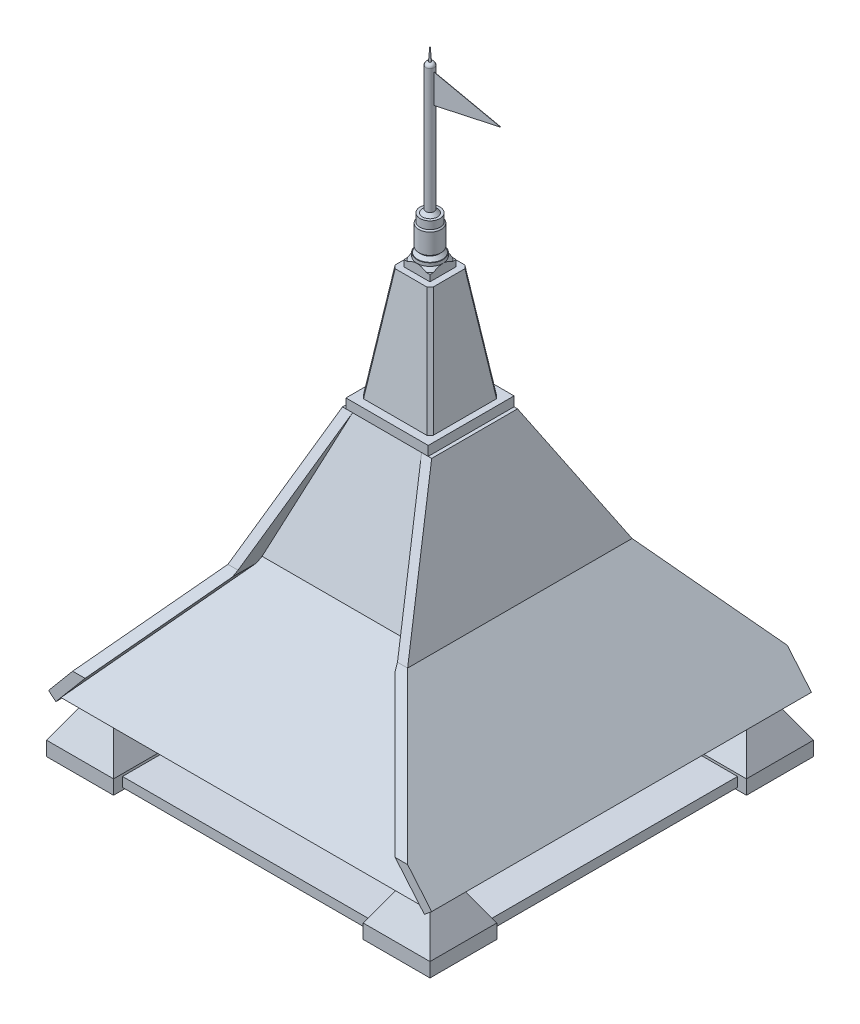
from build123d import *
from OCP.BRepFilletAPI import BRepFilletAPI_MakeChamfer

# Parameters (mm, degrees)
SKETCH2_W                       = 211.424938922
SKETCH2_H                       = 211.424938922
BOSS_EXTRUDE1_DEPTH             = 60
CHAMFER1_SIZE                   = 15
CHAMFER2_SIZE                   = 15
CHAMFER3_SIZE                   = 15
CHAMFER4_SIZE                   = 15
SKETCH3_W                       = 155
SKETCH3_H                       = 30
BOSS_EXTRUDE2_DEPTH             = 788.575061077
BOSS_EXTRUDE3_REACH             = 1172.678
SKETCH5_W                       = 155
SKETCH5_H                       = 30
LPATTERN1_COUNT                 = 2
LPATTERN1_PITCH                 = 1000
LPATTERN2_COUNT                 = 2
LPATTERN2_PITCH                 = 1000
SKETCH6_W                       = 211.424938922
SKETCH6_H                       = 211.424938922
BOSS_EXTRUDE4_DEPTH             = 95
BOSS_EXTRUDE4_TAPER             = 30
LPATTERN3_COUNT                 = 2
LPATTERN3_PITCH                 = 1000
LPATTERN3_COUNT_DIR2            = 2
LPATTERN3_PITCH_DIR2            = 1000
BOSS_EXTRUDE5_DEPTH             = 600
BOSS_EXTRUDE6_REACH             = 1318.399
BOSS_EXTRUDE6_DIRECTION_2_REACH = 1318.399
CUT_EXTRUDE1_DEPTH              = 600
SKETCH11_W                      = 10.919107028
SKETCH11_H                      = 30
CUT_EXTRUDE2_DEPTH              = 1200
SKETCH13_W                      = 220.41661061
SKETCH13_H                      = 220.41661061
BOSS_EXTRUDE7_DEPTH             = 356
BOSS_EXTRUDE7_TAPER             = 8
CHAMFER5_SIZE                   = 10
CHAMFER5_SIZE2                  = 10.199468472
SKETCH14_W                      = 82.13791173
SKETCH14_H                      = 82.486402698
BOSS_EXTRUDE8_DEPTH             = 20
SKETCH15_R                      = 41.068955865
BOSS_EXTRUDE9_DEPTH             = 20
SKETCH16_R                      = 29.12766653
BOSS_EXTRUDE10_DEPTH            = 20
SKETCH17_R                      = 35.403103978
BOSS_EXTRUDE11_DEPTH            = 70
SKETCH18_R                      = 31.555191565
BOSS_EXTRUDE12_DEPTH            = 18
SKETCH19_R                      = 13.358775353
BOSS_EXTRUDE13_DEPTH            = 414
FILLET1_R                       = 10
CHAMFER6_SIZE                   = 10
SKETCH20_R                      = 3.358775353
BOSS_EXTRUDE14_DEPTH            = 42
BOSS_EXTRUDE14_TAPER            = 4
BOSS_EXTRUDE15_DEPTH            = 0.5
BOSS_EXTRUDE16_REACH            = 1999.556
SKETCH23_W                      = 64.215924264
SKETCH23_H                      = 64.215924264


with BuildPart() as part:
    # Sketch2 → Boss-Extrude1 (new body)
    # profile 1 of 8: a face of its own
    with BuildSketch(Plane(origin=(0, 0, 0), x_dir=(1, 0, 0), z_dir=(0, 1, 0))):
        with Locations((-500, 500)):
            Rectangle(SKETCH2_W, SKETCH2_H)
        with BuildLine():
            ThreePointArc((-574.330343737, 510), (-553.033008589, 553.033008589), (-510, 574.330343737))
            ThreePointArc((-510, 574.330343737), (-500, 575), (-490, 574.330343737))
            ThreePointArc((-490, 574.330343737), (-480.178575004, 572.333333333), (-470.711111111, 569.044630404))
            ThreePointArc((-470.711111111, 569.044630404), (-440.369442084, 545.488422292), (-425.669656263, 510))
            Line((-425.669656263, 510), (-475, 510))
            Line((-475, 510), (-475, 490))
            Line((-475, 490), (-425.669656263, 490))
            ThreePointArc((-425.669656263, 490), (-446.966991411, 446.966991411), (-490, 425.669656263))
            Line((-490, 425.669656263), (-490, 475))
            Line((-490, 475), (-510, 475))
            Line((-510, 475), (-510, 425.669656263))
            ThreePointArc((-510, 425.669656263), (-553.033008589, 446.966991411), (-574.330343737, 490))
            Line((-574.330343737, 490), (-525, 490))
            Line((-525, 490), (-525, 510))
            Line((-525, 510), (-574.330343737, 510))
        make_face(mode=Mode.SUBTRACT)
    # profile 2 of 8: a face of its own
    with BuildSketch(Plane(origin=(0, 0, 0), x_dir=(1, 0, 0), z_dir=(0, 1, 0))):
        with Locations((500, 500)):
            Rectangle(SKETCH2_W, SKETCH2_H)
        with BuildLine():
            ThreePointArc((425.669656263, 510), (446.966991411, 553.033008589), (490, 574.330343737))
            ThreePointArc((490, 574.330343737), (500, 575), (510, 574.330343737))
            ThreePointArc((510, 574.330343737), (519.821424996, 572.333333333), (529.288888889, 569.044630404))
            ThreePointArc((529.288888889, 569.044630404), (559.630557916, 545.488422292), (574.330343737, 510))
            Line((574.330343737, 510), (525, 510))
            Line((525, 510), (525, 490))
            Line((525, 490), (574.330343737, 490))
            ThreePointArc((574.330343737, 490), (553.033008589, 446.966991411), (510, 425.669656263))
            Line((510, 425.669656263), (510, 475))
            Line((510, 475), (490, 475))
            Line((490, 475), (490, 425.669656263))
            ThreePointArc((490, 425.669656263), (446.966991411, 446.966991411), (425.669656263, 490))
            Line((425.669656263, 490), (475, 490))
            Line((475, 490), (475, 510))
            Line((475, 510), (425.669656263, 510))
        make_face(mode=Mode.SUBTRACT)
    # profile 3 of 8: a face of its own
    with BuildSketch(Plane(origin=(0, 0, 0), x_dir=(1, 0, 0), z_dir=(0, 1, 0))):
        with Locations((500, -500)):
            Rectangle(SKETCH2_W, SKETCH2_H)
        with BuildLine():
            ThreePointArc((425.669656263, -490), (446.966991411, -446.966991411), (490, -425.669656263))
            ThreePointArc((490, -425.669656263), (500, -425), (510, -425.669656263))
            ThreePointArc((510, -425.669656263), (519.821424996, -427.666666667), (529.288888889, -430.955369596))
            ThreePointArc((529.288888889, -430.955369596), (559.630557916, -454.511577708), (574.330343737, -490))
            Line((574.330343737, -490), (525, -490))
            Line((525, -490), (525, -510))
            Line((525, -510), (574.330343737, -510))
            ThreePointArc((574.330343737, -510), (553.033008589, -553.033008589), (510, -574.330343737))
            Line((510, -574.330343737), (510, -525))
            Line((510, -525), (490, -525))
            Line((490, -525), (490, -574.330343737))
            ThreePointArc((490, -574.330343737), (446.966991411, -553.033008589), (425.669656263, -510))
            Line((425.669656263, -510), (475, -510))
            Line((475, -510), (475, -490))
            Line((475, -490), (425.669656263, -490))
        make_face(mode=Mode.SUBTRACT)
    # profile 4 of 8: a face of its own
    with BuildSketch(Plane(origin=(0, 0, 0), x_dir=(1, 0, 0), z_dir=(0, 1, 0))):
        with Locations((-500, -500)):
            Rectangle(SKETCH2_W, SKETCH2_H)
        with BuildLine():
            ThreePointArc((-574.330343737, -490), (-553.033008589, -446.966991411), (-510, -425.669656263))
            ThreePointArc((-510, -425.669656263), (-500, -425), (-490, -425.669656263))
            ThreePointArc((-490, -425.669656263), (-480.178575004, -427.666666667), (-470.711111111, -430.955369596))
            ThreePointArc((-470.711111111, -430.955369596), (-440.369442084, -454.511577708), (-425.669656263, -490))
            Line((-425.669656263, -490), (-475, -490))
            Line((-475, -490), (-475, -510))
            Line((-475, -510), (-425.669656263, -510))
            ThreePointArc((-425.669656263, -510), (-446.966991411, -553.033008589), (-490, -574.330343737))
            Line((-490, -574.330343737), (-490, -525))
            Line((-490, -525), (-510, -525))
            Line((-510, -525), (-510, -574.330343737))
            ThreePointArc((-510, -574.330343737), (-553.033008589, -553.033008589), (-574.330343737, -510))
            Line((-574.330343737, -510), (-525, -510))
            Line((-525, -510), (-525, -490))
            Line((-525, -490), (-574.330343737, -490))
        make_face(mode=Mode.SUBTRACT)
    # profile 5 of 8: a face of its own
    with BuildSketch(Plane(origin=(0, 0, 0), x_dir=(1, 0, 0), z_dir=(0, 1, 0))):
        with BuildLine():
            ThreePointArc((-490, -425.669656263), (-500, -425), (-510, -425.669656263))
            Line((-510, -425.669656263), (-510, -475))
            Line((-510, -475), (-490, -475))
            Line((-490, -475), (-490, -425.669656263))
        make_face()
    # profile 6 of 8: a face of its own
    with BuildSketch(Plane(origin=(0, 0, 0), x_dir=(1, 0, 0), z_dir=(0, 1, 0))):
        with BuildLine():
            ThreePointArc((510, -425.669656263), (500, -425), (490, -425.669656263))
            Line((490, -425.669656263), (490, -475))
            Line((490, -475), (510, -475))
            Line((510, -475), (510, -425.669656263))
        make_face()
    # profile 7 of 8: a face of its own
    with BuildSketch(Plane(origin=(0, 0, 0), x_dir=(1, 0, 0), z_dir=(0, 1, 0))):
        with BuildLine():
            ThreePointArc((510, 574.330343737), (500, 575), (490, 574.330343737))
            Line((490, 574.330343737), (490, 525))
            Line((490, 525), (510, 525))
            Line((510, 525), (510, 574.330343737))
        make_face()
    # profile 8 of 8: a face of its own
    with BuildSketch(Plane(origin=(0, 0, 0), x_dir=(1, 0, 0), z_dir=(0, 1, 0))):
        with BuildLine():
            ThreePointArc((-490, 574.330343737), (-500, 575), (-510, 574.330343737))
            Line((-510, 574.330343737), (-510, 525))
            Line((-510, 525), (-490, 525))
            Line((-490, 525), (-490, 574.330343737))
        make_face()
    extrude(amount=BOSS_EXTRUDE1_DEPTH)

    # Chamfer1
    chamfer1_edges = [part.edges().sort_by_distance(p)[0] for p in [
        (-500, 0, -394.287530539),
        (-605.712469461, 0, -500),
        (-500, 0, -605.712469461),
        (-394.287530539, 0, -500),
    ]]
    chamfer(chamfer1_edges, length=CHAMFER1_SIZE)

    # Chamfer2
    chamfer2_edges = [part.edges().sort_by_distance(p)[0] for p in [
        (605.712469461, 0, -500),
        (500, 0, -394.287530539),
        (394.287530539, 0, -500),
        (500, 0, -605.712469461),
    ]]
    chamfer(chamfer2_edges, length=CHAMFER2_SIZE)

    # Chamfer3
    chamfer3_edges = [part.edges().sort_by_distance(p)[0] for p in [
        (605.712469461, 0, 500),
        (500, 0, 605.712469461),
        (394.287530539, 0, 500),
        (500, 0, 394.287530539),
    ]]
    chamfer(chamfer3_edges, length=CHAMFER3_SIZE)

    # Chamfer4
    chamfer4_edges = [part.edges().sort_by_distance(p)[0] for p in [
        (-500, 0, 605.712469461),
        (-605.712469461, 0, 500),
        (-500, 0, 394.287530539),
        (-394.287530539, 0, 500),
    ]]
    chamfer(chamfer4_edges, length=CHAMFER4_SIZE)

    # Sketch3 → Boss-Extrude2 (add)
    with BuildSketch(Plane(origin=(0, 0, 394.287530539), x_dir=(-1, 0, 0), z_dir=(0, 0, -1))):
        with Locations((-500, 37.5)):
            Rectangle(SKETCH3_W, SKETCH3_H)
    boss_extrude2 = extrude(amount=BOSS_EXTRUDE2_DEPTH)

    # Sketch5 → Boss-Extrude3 (add, up to next)
    with BuildSketch(Plane.ZY.offset(-394.287530539), mode=Mode.PRIVATE) as boss_extrude3_sk1:
        with Locations((-500, 37.5)):
            Rectangle(SKETCH5_W, SKETCH5_H)
    boss_extrude3_tool1 = extrude(boss_extrude3_sk1.sketch, amount=BOSS_EXTRUDE3_REACH, mode=Mode.PRIVATE) - part.part
    boss_extrude3 = boss_extrude3_tool1.solids().sort_by_distance((394.287531, 37.5, -500))[0]
    add(boss_extrude3)

    # LPattern1: Boss-Extrude2 ×2
    with Locations(*[(-i * LPATTERN1_PITCH, 0, 0) for i in range(1, LPATTERN1_COUNT)]):
        add(boss_extrude2)

    # LPattern2: Boss-Extrude3 ×2
    with Locations(*[(0, 0, i * LPATTERN2_PITCH) for i in range(1, LPATTERN2_COUNT)]):
        add(boss_extrude3)

    # Sketch6 → Boss-Extrude4 (add)
    with BuildSketch(Plane(origin=(0, 60, 0), x_dir=(1, 0, 0), z_dir=(0, 1, 0))):
        with Locations((-500, 500)):
            Rectangle(SKETCH6_W, SKETCH6_H)
    boss_extrude4 = extrude(amount=BOSS_EXTRUDE4_DEPTH, taper=BOSS_EXTRUDE4_TAPER)

    # LPattern3: Boss-Extrude4 2 × 2
    with Locations(*[(i * LPATTERN3_PITCH, 0, j * LPATTERN3_PITCH_DIR2) for i in range(LPATTERN3_COUNT) for j in range(LPATTERN3_COUNT_DIR2) if (i, j) != (0, 0)]):
        add(boss_extrude4)


with BuildPart() as body_2:
    # Sketch7 → Boss-Extrude5 (new, symmetric)
    with BuildSketch(Plane.XY):
        Polygon((-130, 999.565364388), (130, 999.565364388), (283.909064497, 576.703685035), (605.30286934, 193.681463475), (582.321536046, 174.397835184), (257.527507249, 561.472285856), (155.788720062, 840.997306337), (108.993773854, 969.565364388), (-108.993773854, 969.565364388), (-155.788720062, 840.997306337), (-257.527507249, 561.472285856), (-582.321536046, 174.397835184), (-605.30286934, 193.681463475), (-283.909064497, 576.703685035), align=None)
    extrude(amount=BOSS_EXTRUDE5_DEPTH, both=True)

    # Sketch9 → Boss-Extrude6 (add, up to next)
    with BuildSketch(Plane(origin=(0, 0, 0), x_dir=(0, 0, -1), z_dir=(1, 0, 0)), mode=Mode.PRIVATE) as boss_extrude6_sk1:
        Polygon((-135.30286934, 999.565364388), (124.69713066, 999.565364388), (278.606195157, 576.703685035), (600, 193.681463475), (577.018666706, 174.397835184), (252.22463791, 561.472285856), (150.485850722, 840.997306337), (103.690904514, 969.565364388), (-114.296643194, 969.565364388), (-161.091589402, 840.997306337), (-262.830376589, 561.472285856), (-587.624405386, 174.397835184), (-610.60573868, 193.681463475), (-289.211933836, 576.703685035), align=None)
    boss_extrude6_tool1 = extrude(boss_extrude6_sk1.sketch, amount=BOSS_EXTRUDE6_REACH, mode=Mode.PRIVATE) - body_2.part
    boss_extrude6 = boss_extrude6_tool1.solids().sort_by_distance((0, 984.914536, 5.302869))[0]
    add(boss_extrude6)

    # Sketch9 → Boss-Extrude6 direction 2 (add, up to next)
    with BuildSketch(Plane(origin=(0, 0, 0), x_dir=(0, 0, -1), z_dir=(1, 0, 0)), mode=Mode.PRIVATE) as boss_extrude6_direction_2_sk1:
        Polygon((-135.30286934, 999.565364388), (124.69713066, 999.565364388), (278.606195157, 576.703685035), (600, 193.681463475), (577.018666706, 174.397835184), (252.22463791, 561.472285856), (150.485850722, 840.997306337), (103.690904514, 969.565364388), (-114.296643194, 969.565364388), (-161.091589402, 840.997306337), (-262.830376589, 561.472285856), (-587.624405386, 174.397835184), (-610.60573868, 193.681463475), (-289.211933836, 576.703685035), align=None)
    boss_extrude6_direction_2_tool1 = extrude(boss_extrude6_direction_2_sk1.sketch, amount=-BOSS_EXTRUDE6_DIRECTION_2_REACH, mode=Mode.PRIVATE) - body_2.part
    boss_extrude6_direction_2 = boss_extrude6_direction_2_tool1.solids().sort_by_distance((0, 984.914536, 5.302869))[0]
    add(boss_extrude6_direction_2)

    # Mirror1: Boss-Extrude6, Boss-Extrude6 direction 2 across plane
    add(boss_extrude6.mirror(Plane.XY))
    add(boss_extrude6_direction_2.mirror(Plane.XY))

    # Sketch10 → Cut-Extrude1 (cut, symmetric)
    with BuildSketch(Plane(origin=(0, 0, 0), x_dir=(0, 0, -1), z_dir=(1, 0, 0))):
        Polygon((-600, 284.341968258), (-354.679391282, 576.703685035), (-135.616237688, 969.565364388), (-135.616237688, 999.565364388), (-600, 999.565364388), align=None)
        Polygon((135.616237688, 999.565364388), (135.616237688, 969.565364388), (354.679391282, 576.703685035), (600, 284.341968258), (600, 999.565364388), align=None)
    extrude(amount=CUT_EXTRUDE1_DEPTH, both=True, mode=Mode.SUBTRACT)

    # Sketch11 → Cut-Extrude2 (cut)
    with BuildSketch(Plane(origin=(0, 0, -135.616237688), x_dir=(-1, 0, 0), z_dir=(0, 0, -1))):
        with Locations((135.459553514, 984.565364388)):
            Rectangle(SKETCH11_W, SKETCH11_H)
        with Locations((-135.459553514, 984.565364388)):
            Rectangle(SKETCH11_W, SKETCH11_H)
    extrude(amount=-CUT_EXTRUDE2_DEPTH, mode=Mode.SUBTRACT)

    # Sketch13 → Boss-Extrude7 (add)
    with BuildSketch(Plane(origin=(0, 999.565364388, 0), x_dir=(1, 0, 0), z_dir=(0, 1, 0))):
        Rectangle(SKETCH13_W, SKETCH13_H)
    extrude(amount=BOSS_EXTRUDE7_DEPTH, taper=BOSS_EXTRUDE7_TAPER)

    # Chamfer5: one chamfer whose edges measure the first distance from different faces: ONE call of the kernel's chamfer builder (chamfer() names one face for all edges)
    chamfer5_edges_1 = [body_2.edges().sort_by_distance(p)[0] for p in [
        (85.192036728, 1177.565364388, 85.192036728),
    ]]
    chamfer5_side_1 = [body_2.faces().sort_by_distance(p)[0] for p in [
        (0, 1160.142390842, 87.640675973),
    ]]
    chamfer5_edges_2 = [body_2.edges().sort_by_distance(p)[0] for p in [
        (85.192036728, 1177.565364388, -85.192036728),
    ]]
    chamfer5_side_2 = [body_2.faces().sort_by_distance(p)[0] for p in [
        (87.640675973, 1160.142390842, 0),
    ]]
    chamfer5_edges_3 = [body_2.edges().sort_by_distance(p)[0] for p in [
        (-85.192036728, 1177.565364388, -85.192036728),
    ]]
    chamfer5_side_3 = [body_2.faces().sort_by_distance(p)[0] for p in [
        (0, 1160.142390842, -87.640675973),
    ]]
    chamfer5_edges_4 = [body_2.edges().sort_by_distance(p)[0] for p in [
        (-85.192036728, 1177.565364388, 85.192036728),
    ]]
    chamfer5_side_4 = [body_2.faces().sort_by_distance(p)[0] for p in [
        (-87.640675973, 1160.142390842, 0),
    ]]
    chamfer5 = BRepFilletAPI_MakeChamfer(body_2.part.solid().wrapped)
    for e in chamfer5_edges_1:
        chamfer5.Add(CHAMFER5_SIZE, CHAMFER5_SIZE2, e.wrapped, chamfer5_side_1[0].wrapped)  # the first distance lies on this face
    for e in chamfer5_edges_2:
        chamfer5.Add(CHAMFER5_SIZE, CHAMFER5_SIZE2, e.wrapped, chamfer5_side_2[0].wrapped)  # the first distance lies on this face
    for e in chamfer5_edges_3:
        chamfer5.Add(CHAMFER5_SIZE, CHAMFER5_SIZE2, e.wrapped, chamfer5_side_3[0].wrapped)  # the first distance lies on this face
    for e in chamfer5_edges_4:
        chamfer5.Add(CHAMFER5_SIZE, CHAMFER5_SIZE2, e.wrapped, chamfer5_side_4[0].wrapped)  # the first distance lies on this face
    add(Compound.cast(chamfer5.Shape()), mode=Mode.REPLACE)

    # Sketch14 → Boss-Extrude8 (add)
    with BuildSketch(Plane(origin=(0, 1355.565364388, 0), x_dir=(1, 0, 0), z_dir=(0, 1, 0))):
        Rectangle(SKETCH14_W, SKETCH14_H)
    extrude(amount=BOSS_EXTRUDE8_DEPTH)

    # Sketch15 → Boss-Extrude9 (add)
    with BuildSketch(Plane(origin=(0, 1375.565364388, 0), x_dir=(1, 0, 0), z_dir=(0, 1, 0))):
        with Locations(Location((0, 0, 0), (0, 0, 180))):
            Circle(SKETCH15_R)
    extrude(amount=BOSS_EXTRUDE9_DEPTH)

    # Sketch16 → Boss-Extrude10 (add)
    with BuildSketch(Plane(origin=(0, 1395.565364388, 0), x_dir=(1, 0, 0), z_dir=(0, 1, 0))):
        with Locations(Location((0, 0, 0), (0, 0, 270))):
            Circle(SKETCH16_R)
    extrude(amount=BOSS_EXTRUDE10_DEPTH)

    # Sketch17 → Boss-Extrude11 (add)
    with BuildSketch(Plane(origin=(0, 1415.565364388, 0), x_dir=(1, 0, 0), z_dir=(0, 1, 0))):
        with Locations(Location((0, 0, 0), (0, 0, 270))):
            Circle(SKETCH17_R)
    extrude(amount=BOSS_EXTRUDE11_DEPTH)

    # Sketch18 → Boss-Extrude12 (add)
    with BuildSketch(Plane(origin=(0, 1485.565364388, 0), x_dir=(1, 0, 0), z_dir=(0, 1, 0))):
        with Locations(Location((0, 0, 0), (0, 0, 90))):
            Circle(SKETCH18_R)
    extrude(amount=BOSS_EXTRUDE12_DEPTH)

    # Sketch19 → Boss-Extrude13 (add)
    with BuildSketch(Plane(origin=(0, 1503.565364388, 0), x_dir=(1, 0, 0), z_dir=(0, 1, 0))):
        with Locations(Location((0, 0, 0), (0, 0, 270))):
            Circle(SKETCH19_R)
    extrude(amount=BOSS_EXTRUDE13_DEPTH)

    # Fillet1
    fillet1_edges = [body_2.edges().sort_by_distance(p)[0] for p in [
        (0, 1917.565364388, -13.358775353),
    ]]
    fillet(fillet1_edges, radius=FILLET1_R)

    # Chamfer6
    # the kernel refuses this chamfer: 10 mm, written as the material it adds along each edge
    with BuildSketch(Plane(origin=(0, 1375.565364388, 0), x_dir=(-1, 0, 0), z_dir=(0, 0, -1))) as chamfer6_piece_1_section:
        Polygon((41.068955865, CHAMFER6_SIZE), (41.068955865 + CHAMFER6_SIZE, 0), (41.068955865, 0), align=None)
    chamfer6_piece_1 = revolve(axis=Axis((0, 1375.565364388, 0), (0, 1, 0)), revolution_arc=180, mode=Mode.PRIVATE)
    chamfer6_piece_1 = split(chamfer6_piece_1, bisect_by=Plane(origin=(-41.068955865, 1383.788299883, 21.312612346), z_dir=(1, 0, 0)), keep=Keep.TOP, mode=Mode.PRIVATE)
    chamfer6_piece_1 = split(chamfer6_piece_1, bisect_by=Plane(origin=(-36.914527426, 1383.788299883, 41.243201349), z_dir=(0, 0, -1)), keep=Keep.TOP, mode=Mode.PRIVATE)
    chamfer6_piece_1 = split(chamfer6_piece_1, bisect_by=Plane(origin=(41.068955865, 1383.788299883, 21.312612346), z_dir=(-1, 0, 0)), keep=Keep.TOP, mode=Mode.PRIVATE)
    add(chamfer6_piece_1)
    with BuildSketch(Plane(origin=(0, 1375.565364388, 0), x_dir=(1, 0, 0), z_dir=(0, 0, 1))) as chamfer6_piece_2_section:
        Polygon((41.068955865, CHAMFER6_SIZE), (41.068955865 + CHAMFER6_SIZE, 0), (41.068955865, 0), align=None)
    chamfer6_piece_2 = revolve(axis=Axis((0, 1375.565364388, 0), (0, 1, 0)), revolution_arc=180, mode=Mode.PRIVATE)
    chamfer6_piece_2 = split(chamfer6_piece_2, bisect_by=Plane(origin=(-41.068955865, 1383.788299883, -21.312612346), z_dir=(1, 0, 0)), keep=Keep.TOP, mode=Mode.PRIVATE)
    chamfer6_piece_2 = split(chamfer6_piece_2, bisect_by=Plane(origin=(41.068955865, 1383.788299883, -21.312612346), z_dir=(-1, 0, 0)), keep=Keep.TOP, mode=Mode.PRIVATE)
    chamfer6_piece_2 = split(chamfer6_piece_2, bisect_by=Plane(origin=(36.914527426, 1383.788299883, -41.243201349), z_dir=(0, 0, 1)), keep=Keep.TOP, mode=Mode.PRIVATE)
    add(chamfer6_piece_2)
    with BuildSketch(Plane(origin=(0, 1395.565364388, 0), x_dir=(0, 0, 1), z_dir=(-1, 0, 0))) as chamfer6_piece_3:
        Polygon((29.12766653, CHAMFER6_SIZE), (29.12766653 + CHAMFER6_SIZE, 0), (29.12766653, 0), align=None)
    revolve(axis=Axis((0, 1395.565364388, 0), (0, 1, 0)))
    with BuildSketch(Plane(origin=(0, 1415.565364388, 0), x_dir=(0, 0, 1), z_dir=(-1, 0, 0))) as chamfer6_piece_4_section:
        Polygon((29.12766653 + CHAMFER6_SIZE, 0), (29.12766653, -CHAMFER6_SIZE), (29.12766653, 0), align=None)
    chamfer6_piece_4 = revolve(axis=Axis((0, 1415.565364388, 0), (0, 1, 0)), mode=Mode.PRIVATE)
    chamfer6_piece_4 = chamfer6_piece_4 & Plane(origin=(0, 1408.847960191, 0), x_dir=(0, 0, 1), z_dir=(0, -1, 0)) * Cylinder(35.403103978, 157, mode=Mode.PRIVATE)
    add(chamfer6_piece_4)
    with BuildSketch(Plane(origin=(0, 1503.565364388, 0), x_dir=(0, 0, 1), z_dir=(-1, 0, 0))) as chamfer6_piece_5:
        Polygon((13.358775353, CHAMFER6_SIZE), (13.358775353 + CHAMFER6_SIZE, 0), (13.358775353, 0), align=None)
    revolve(axis=Axis((0, 1503.565364388, 0), (0, 1, 0)))
    # the kernel refuses this chamfer: 10 mm, written as the material it takes off along each edge
    with BuildSketch(Plane(origin=(0, 1485.565364388, 0), x_dir=(0, 0, 1), z_dir=(-1, 0, 0))) as chamfer6_2_piece_1_section:
        Polygon((35.403103978 - CHAMFER6_SIZE, 0), (35.403103978, -CHAMFER6_SIZE), (35.403103978, 0), align=None)
    chamfer6_2_piece_1 = revolve(axis=Axis((0, 1485.565364388, 0), (0, 1, 0)), mode=Mode.PRIVATE)
    chamfer6_2_piece_1 = chamfer6_2_piece_1 - Plane(origin=(0, 1477.621735488, 0), x_dir=(0, 0, -1), z_dir=(0, -1, 0)) * Cylinder(31.555191565, 142, mode=Mode.PRIVATE)
    add(chamfer6_2_piece_1, mode=Mode.SUBTRACT)

    # Sketch20 → Boss-Extrude14 (add)
    with BuildSketch(Plane(origin=(0, 1917.565364388, 0), x_dir=(1, 0, 0), z_dir=(0, 1, 0))):
        Circle(SKETCH20_R)
    extrude(amount=BOSS_EXTRUDE14_DEPTH, taper=BOSS_EXTRUDE14_TAPER)

    # Sketch23 → Boss-Extrude16 (add, up to next)
    with BuildSketch(Plane(origin=(0, 155, 0), x_dir=(1, 0, 0), z_dir=(0, 1, 0)), mode=Mode.PRIVATE) as boss_extrude16_sk1:
        with Locations((-500, 500)):
            Rectangle(SKETCH23_W, SKETCH23_H)
    boss_extrude16_tool1 = extrude(boss_extrude16_sk1.sketch, amount=BOSS_EXTRUDE16_REACH, mode=Mode.PRIVATE) - body_2.part
    # Sketch23 → Boss-Extrude16 (add, up to next)
    with BuildSketch(Plane(origin=(0, 155, 0), x_dir=(1, 0, 0), z_dir=(0, 1, 0)), mode=Mode.PRIVATE) as boss_extrude16_sk2:
        with Locations((500, 500)):
            Rectangle(SKETCH23_W, SKETCH23_H)
    boss_extrude16_tool2 = extrude(boss_extrude16_sk2.sketch, amount=BOSS_EXTRUDE16_REACH, mode=Mode.PRIVATE) - body_2.part
    # Sketch23 → Boss-Extrude16 (add, up to next)
    with BuildSketch(Plane(origin=(0, 155, 0), x_dir=(1, 0, 0), z_dir=(0, 1, 0)), mode=Mode.PRIVATE) as boss_extrude16_sk3:
        with Locations((500, -500)):
            Rectangle(SKETCH23_W, SKETCH23_H)
    boss_extrude16_tool3 = extrude(boss_extrude16_sk3.sketch, amount=BOSS_EXTRUDE16_REACH, mode=Mode.PRIVATE) - body_2.part
    # Sketch23 → Boss-Extrude16 (add, up to next)
    with BuildSketch(Plane(origin=(0, 155, 0), x_dir=(1, 0, 0), z_dir=(0, 1, 0)), mode=Mode.PRIVATE) as boss_extrude16_sk4:
        with Locations((-500, -500)):
            Rectangle(SKETCH23_W, SKETCH23_H)
    boss_extrude16_tool4 = extrude(boss_extrude16_sk4.sketch, amount=BOSS_EXTRUDE16_REACH, mode=Mode.PRIVATE) - body_2.part

    add(part.part)  # Boss-Extrude16 merges part
    add(boss_extrude16_tool1.solids().sort_by_distance((-500, 155, -500))[0])
    add(boss_extrude16_tool2.solids().sort_by_distance((500, 155, -500))[0])
    add(boss_extrude16_tool3.solids().sort_by_distance((500, 155, 500))[0])
    add(boss_extrude16_tool4.solids().sort_by_distance((-500, 155, 500))[0])


with BuildPart() as body_3:
    # Sketch21 → Boss-Extrude15 (new, symmetric)
    with BuildSketch(Plane.XY):
        Polygon((13.358775353, 1895.144996287), (223.609190144, 1849.615245121), (13.358775353, 1804.085493956), align=None)
    extrude(amount=BOSS_EXTRUDE15_DEPTH, both=True)


solid = Compound([body_2.part, body_3.part])
